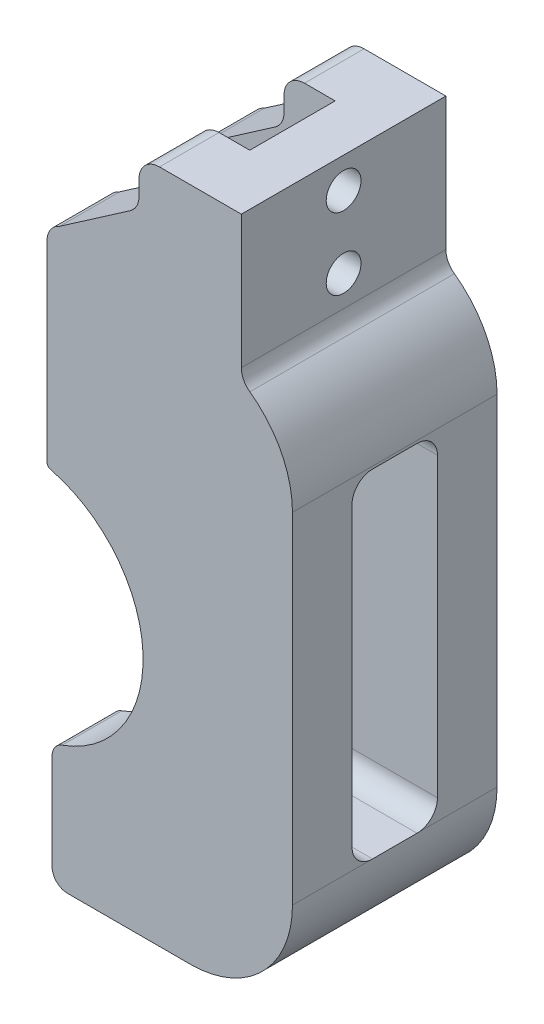
from build123d import *

# Parameters (mm, degrees)
SKETCH_1_R          = 1.7
EXTRUDE_1_DEPTH     = 20
SKETCH_2_W          = 31.643510299
SKETCH_2_H          = 8.35
CUT_EXTRUDE_1_DEPTH = 75.850374033
SKETCH_4_R          = 1.7
CUT_EXTRUDE_3_DEPTH = 73.237455658
FILLET_1_R          = 0.5
FILLET_2_R          = 2
SKETCH_5_W          = 3.571488154
SKETCH_5_H          = 19.286036032
CUT_EXTRUDE_4_DEPTH = 75.850374033
FILLET_3_R          = 1.5
SKETCH_6_W          = 14.583576629
SKETCH_6_H          = 57.679533687
CUT_EXTRUDE_5_DEPTH = 75.850374033
FILLET_4_R          = 10
SKETCH_7_W          = 8.35
SKETCH_7_H          = 33
CUT_EXTRUDE_6_DEPTH = 71.370448485
FILLET_5_R          = 2


# Some blends are built 0.0001 mm under size
with BuildPart() as part:
    # 草图1 → 凸台-拉伸1 (new body)
    with BuildSketch(Plane.XY):
        with BuildLine():
            Line((0, 0), (10, 0))
            Line((10, 0), (10, -15))
            Line((10, -15), (29.096021943, -15))
            Line((29.096021943, -15), (29.096021943, -66))
            Line((29.096021943, -66), (-11.5, -66))
            Line((-11.5, -66), (-11.5, -54.4))
            ThreePointArc((-11.5, -54.4), (0.333421668, -43.75703287), (-9, -30.865568342))
            Line((-9, -30.865568342), (-9, -9.911704997))
            Line((-9, -9.911704997), (-7.763036189, -9.911704997))
            Line((-7.763036189, -9.911704997), (0, -4.543101007))
            Line((0, -4.543101007), (0, 0))
        make_face()
        with Locations((19.5, -30.6)):
            Circle(SKETCH_1_R, mode=Mode.SUBTRACT)
        with Locations((19.5, -56)):
            Circle(SKETCH_1_R, mode=Mode.SUBTRACT)
    extrude(amount=EXTRUDE_1_DEPTH)

    # 草图2 → 切除-拉伸1 (cut, through all)
    with BuildSketch(Plane(origin=(0, 0, 0), x_dir=(1, 0, 0), z_dir=(0, 1, 0))):
        with Locations((-10.82175515, -10)):
            Rectangle(SKETCH_2_W, SKETCH_2_H)
    extrude(amount=-CUT_EXTRUDE_1_DEPTH, mode=Mode.SUBTRACT)

    # 草图4 → 切除-拉伸3 (cut, through all)
    with BuildSketch(Plane(origin=(10, 0, 0), x_dir=(0, 0, -1), z_dir=(1, 0, 0))):
        with Locations(Location((-10, -3, 0), (0, 0, 90))):
            Circle(SKETCH_4_R)
        with Locations(Location((-10, -10, 0), (0, 0, 90))):
            Circle(SKETCH_4_R)
    extrude(amount=-CUT_EXTRUDE_3_DEPTH, mode=Mode.SUBTRACT)

    # 圆角1
    fillet_1_edges = [part.edges().sort_by_distance(p)[0] for p in [
        (-11.5, -66, 17.0875),
        (-9, -30.865568342, 17.0875),
        (-11.5, -66, 2.9125),
        (-9, -30.865568342, 2.9125),
    ]]
    fillet(fillet_1_edges, radius=FILLET_1_R)

    # 圆角2
    # the kernel refuses this fillet: 2 mm, written as the material it adds along each edge
    with BuildSketch(Plane(origin=(0, -4.543101007, 14.175), x_dir=(0, 1, 0), z_dir=(0, 0, 1)), Plane(origin=(0, -4.543101007, 0), x_dir=(0, 1, 0), z_dir=(0, 0, 1))) as fillet_2_piece_1:
        with BuildLine():
            CenterArc((FILLET_2_R * 0.524275273185, FILLET_2_R), FILLET_2_R, 214.666177241, 55.333822759)
            Line((-FILLET_2_R * 0.298204680815, FILLET_2_R * 0.431205902572), (0, 0))
            Line((0, 0), (FILLET_2_R * 0.524275273185, 0))
        make_face()
    extrude(amount=5.825)
    with BuildSketch(Plane(origin=(10, -15, 0), x_dir=(1, 0, 0), z_dir=(0, 0, 1))) as fillet_2_piece_2:
        with BuildLine():
            CenterArc((FILLET_2_R, FILLET_2_R), FILLET_2_R, 180, 90)
            Line((0, FILLET_2_R), (0, 0))
            Line((0, 0), (FILLET_2_R, 0))
        make_face()
    extrude(amount=20)
    # the kernel refuses this fillet: 2 mm, written as the material it takes off along each edge
    with BuildSketch(Plane(origin=(-9, -9.911704997, -4.621806853), x_dir=(0, -1, 0), z_dir=(0, 0, 1)), Plane(origin=(-9, -9.911704997, 9.553193147), x_dir=(0, -1, 0), z_dir=(0, 0, 1))) as fillet_2_2_piece_1:
        with BuildLine():
            CenterArc((1.848722741, 2), FILLET_2_R, 202.427748684, 67.572251316)
            Line((0, 1.236963811), (0, 0))
            Line((0, 0), (1.848722741, 0))
        make_face()
    extrude(amount=15.068613706, mode=Mode.SUBTRACT)
    with BuildSketch(Plane(origin=(0, 0, -5), x_dir=(1, 0, 0), z_dir=(0, 0, 1)), Plane(origin=(0, 0, 9.175), x_dir=(1, 0, 0), z_dir=(0, 0, 1))) as fillet_2_2_piece_2:
        with BuildLine():
            CenterArc((FILLET_2_R, -FILLET_2_R), FILLET_2_R, 90, 90)
            Line((0, -FILLET_2_R), (0, 0))
            Line((0, 0), (FILLET_2_R, 0))
        make_face()
    extrude(amount=15.825, mode=Mode.SUBTRACT)
    with BuildSketch(Plane(origin=(29.096021943, -15, -5), x_dir=(0, -1, 0), z_dir=(0, 0, 1)), Plane(origin=(29.096021943, -66, -5), x_dir=(-1, 0, 0), z_dir=(0, 0, 1))) as fillet_2_2_piece_3:
        with BuildLine():
            CenterArc((FILLET_2_R, -FILLET_2_R), FILLET_2_R, 90, 90)
            Line((0, -FILLET_2_R), (0, 0))
            Line((0, 0), (FILLET_2_R, 0))
        make_face()
    extrude(amount=30, mode=Mode.SUBTRACT)

    # 草图5 → 切除-拉伸4 (cut, through all)
    with BuildSketch(Plane.XY.offset(20)):
        with Locations((-10.285744077, -57.827803492)):
            Rectangle(SKETCH_5_W, SKETCH_5_H)
    extrude(amount=-CUT_EXTRUDE_4_DEPTH, mode=Mode.SUBTRACT)

    # 圆角3
    fillet_3_edges = [part.edges().sort_by_distance(p)[0] for p in [
        (-8.5, -54.015641537, 2.9125),
        (-8.5, -66, 2.9125),
        (-8.5, -54.015641537, 17.0875),
        (-8.5, -66, 17.0875),
    ]]
    fillet(fillet_3_edges, radius=FILLET_3_R)

    # 草图6 → 切除-拉伸5 (cut, through all)
    with BuildSketch(Plane(origin=(0, 0, 0), x_dir=(-1, 0, 0), z_dir=(0, 0, -1))):
        with Locations((-22.291788315, -40.000125123)):
            Rectangle(SKETCH_6_W, SKETCH_6_H)
    extrude(amount=-CUT_EXTRUDE_5_DEPTH, mode=Mode.SUBTRACT)

    # 圆角4
    fillet_4_edges = [part.edges().sort_by_distance(p)[0] for p in [
        (15, -66, 10),
        (15, -15, 10),
    ]]
    fillet(fillet_4_edges, radius=FILLET_4_R - 0.0001)  # a hair under: the kernel refuses the full size

    # 草图7 → 切除-拉伸6 (cut, through all)
    with BuildSketch(Plane.ZY.offset(-5)):
        with Locations((10, -39.5)):
            Rectangle(SKETCH_7_W, SKETCH_7_H)
    extrude(amount=-CUT_EXTRUDE_6_DEPTH, mode=Mode.SUBTRACT)

    # 圆角5
    fillet_5_edges = [part.edges().sort_by_distance(p)[0] for p in [
        (10, -56, 5.825),
        (10, -23, 5.825),
        (10, -23, 14.175),
        (10, -56, 14.175),
    ]]
    fillet(fillet_5_edges, radius=FILLET_5_R)


solid = part.part
